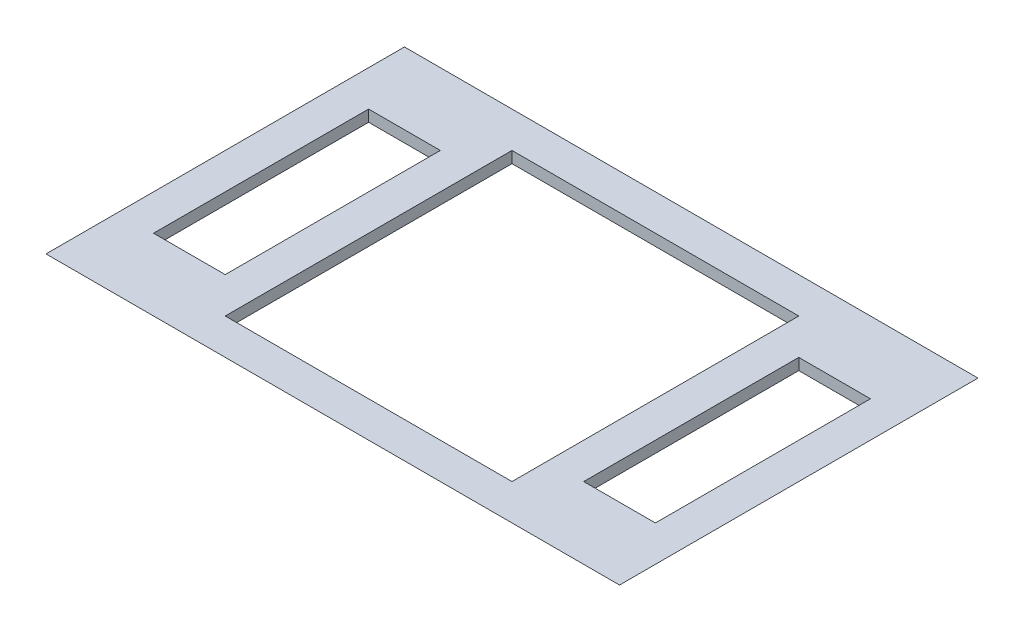
from build123d import *

# Parameters (mm, degrees)
SKETCH1_W           = 75
SKETCH1_H           = 225
SKETCH1_W_2         = 300
SKETCH1_H_2         = 300
BOSS_EXTRUDE1_DEPTH = 12
CHAMFER1_SIZE       = 12


with BuildPart() as part:
    # Sketch1 → Boss-Extrude1 (new body)
    with BuildSketch(Plane(origin=(0, 0, 0), x_dir=(1, 0, 0), z_dir=(0, 1, 0))):
        Polygon((0, 375), (0, 0), (600, 0), (600, 375), (375, 375), (225, 375), align=None)
        with Locations((75, 187.5)):
            Rectangle(SKETCH1_W, SKETCH1_H, mode=Mode.SUBTRACT)
        with Locations((300, 187.5)):
            Rectangle(SKETCH1_W_2, SKETCH1_H_2, mode=Mode.SUBTRACT)
        with Locations((525, 187.5)):
            Rectangle(SKETCH1_W, SKETCH1_H, mode=Mode.SUBTRACT)
    extrude(amount=BOSS_EXTRUDE1_DEPTH)

    # Chamfer1
    chamfer1_edges = [part.edges().sort_by_distance(p)[0] for p in [
        (300, 0, -375),
        (0, 0, -187.5),
        (300, 0, 0),
        (600, 0, -187.5),
    ]]
    chamfer(chamfer1_edges, length=CHAMFER1_SIZE - 0.0001)  # a hair under: the kernel refuses the full size


solid = part.part
